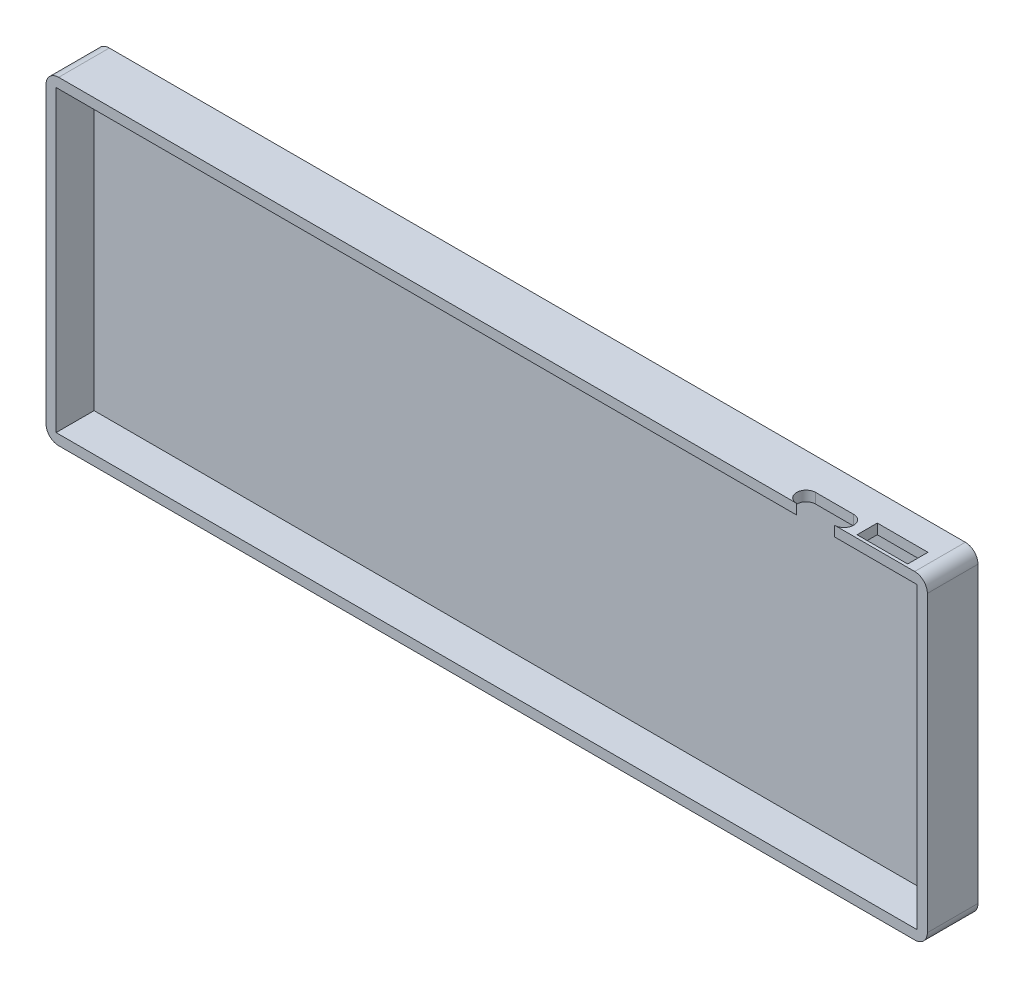
from build123d import *

# Parameters (mm, degrees)
SKETCH1_W           = 348
SKETCH1_H           = 126
BOSS_EXTRUDE1_DEPTH = 20
SKETCH2_W           = 340
SKETCH2_H           = 118
CUT_EXTRUDE1_DEPTH  = 15
CUT_EXTRUDE2_REACH  = 217.759
CUT_EXTRUDE3_REACH  = 217.759
SKETCH5_W           = 20
SKETCH5_H           = 8
FILLET1_R           = 5


with BuildPart() as part:
    # Sketch1 → Boss-Extrude1 (new body)
    with BuildSketch(Plane.XY):
        Rectangle(SKETCH1_W, SKETCH1_H)
    extrude(amount=BOSS_EXTRUDE1_DEPTH)

    # Sketch2 → Cut-Extrude1 (cut)
    with BuildSketch(Plane.XY.offset(20)):
        Rectangle(SKETCH2_W, SKETCH2_H)
    extrude(amount=-CUT_EXTRUDE1_DEPTH, mode=Mode.SUBTRACT)

    # Sketch4 → Cut-Extrude2 (cut, up to next)
    with BuildSketch(Plane(origin=(0, 63, 0), x_dir=(1, 0, 0), z_dir=(0, 1, 0)), mode=Mode.PRIVATE) as cut_extrude2_sk1:
        with BuildLine():
            Line((122.39, -12.5), (137.39, -12.5))
            ThreePointArc((137.39, -12.5), (141.14, -16.25), (137.39, -20))
            Line((137.39, -20), (122.39, -20))
            ThreePointArc((122.39, -20), (118.64, -16.25), (122.39, -12.5))
        make_face()
    cut_extrude2_tool1 = extrude(cut_extrude2_sk1.sketch, amount=-CUT_EXTRUDE2_REACH, mode=Mode.PRIVATE) & part.part
    add(cut_extrude2_tool1.solids().sort_by_distance((129.89, 63, 16.25))[0], mode=Mode.SUBTRACT)

    # Sketch5 → Cut-Extrude3 (cut, up to next)
    with BuildSketch(Plane(origin=(0, 63, 0), x_dir=(1, 0, 0), z_dir=(0, 1, 0)), mode=Mode.PRIVATE) as cut_extrude3_sk1:
        with Locations((155.05, -14.81)):
            Rectangle(SKETCH5_W, SKETCH5_H)
    cut_extrude3_tool1 = extrude(cut_extrude3_sk1.sketch, amount=-CUT_EXTRUDE3_REACH, mode=Mode.PRIVATE) & part.part
    add(cut_extrude3_tool1.solids().sort_by_distance((155.05, 63, 14.81))[0], mode=Mode.SUBTRACT)

    # Fillet1
    fillet1_edges = [part.edges().sort_by_distance(p)[0] for p in [
        (-174, 63, 10),
        (-174, -63, 10),
        (174, -63, 10),
        (174, 63, 10),
    ]]
    fillet(fillet1_edges, radius=FILLET1_R)


solid = part.part
